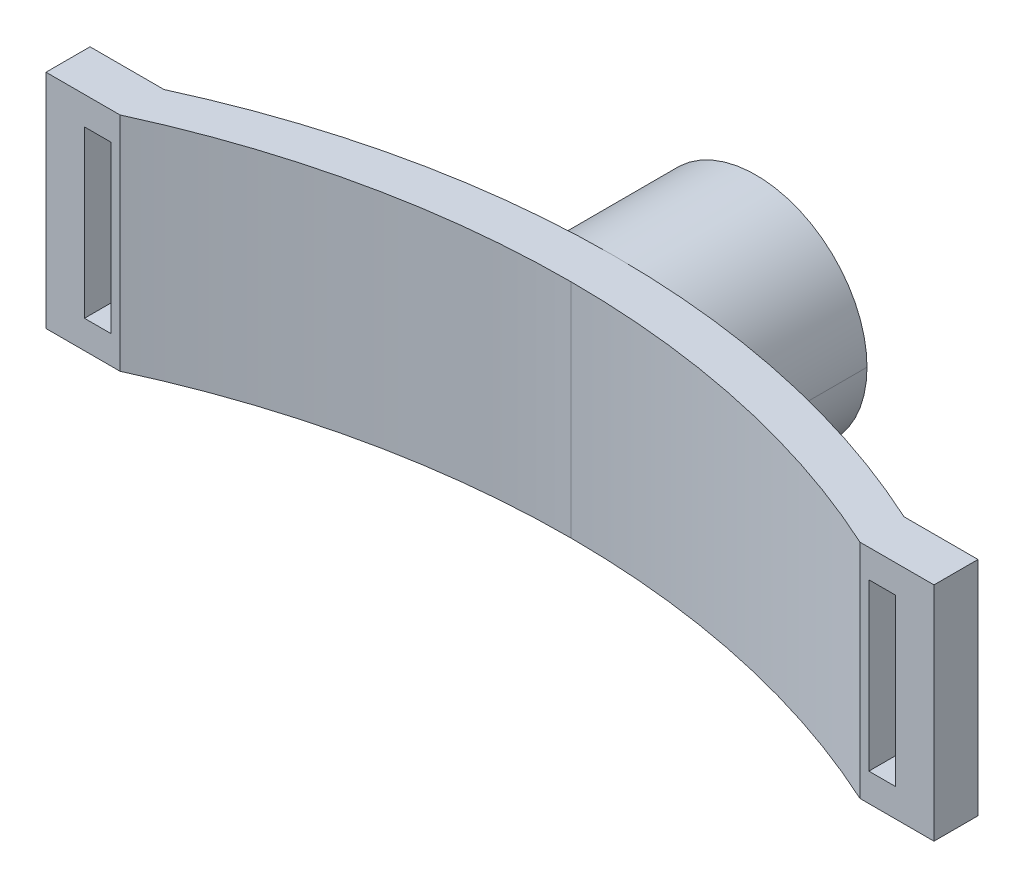
from build123d import *

# Parameters (mm, degrees)
BOSS_EXTRUDE1_START         = -15
BOSS_EXTRUDE1_DEPTH         = 30
BOSS_EXTRUDE1_START_2       = -12.7
BOSS_EXTRUDE1_2_OUTLINE_W   = 10
BOSS_EXTRUDE1_2_OUTLINE_H   = 5.949524979
BOSS_EXTRUDE1_2_DEPTH       = 25.4
BOSS_EXTRUDE1_3_OUTLINE_R   = 15
BOSS_EXTRUDE1_3_OUTLINE_R_2 = 4.55
BOSS_EXTRUDE1_3_DEPTH       = 19.994560744
SKETCH4_W                   = 3.6
SKETCH4_H                   = 22.4
CUT_EXTRUDE1_DEPTH          = 6
BOSS_EXTRUDE2_REACH         = 73.536
BOSS_EXTRUDE2_END_RADIUS    = 119.634966004
SKETCH9_R                   = 6.57997386
SKETCH9_R_2                 = 3.45
SKETCH10_W                  = 5.949524979
SKETCH10_H                  = 2.3
BOSS_EXTRUDE3_DEPTH         = 10
SKETCH11_W                  = 5.949524979
SKETCH11_H                  = 30
BOSS_EXTRUDE4_DEPTH         = 10
SKETCH13_W                  = 3.6
SKETCH13_H                  = 22.4
CUT_EXTRUDE2_DEPTH          = 10
CUT_EXTRUDE3_DEPTH          = 5


with BuildPart() as part:
    # Boss-Extrude1: read off the stored shape, not the designer's step
    # Boss-Extrude1 outline → Boss-Extrude1 (new body)
    with BuildSketch(Plane(origin=(0, 0, 0), x_dir=(1, 0, 0), z_dir=(0, 1, 0)).offset(BOSS_EXTRUDE1_START)):
        with BuildLine():
            Line((-50, -30), (-50, -35.949524979))
            ThreePointArc((-50, -35.949524979), (-25.592440765, -27.769436157), (0, -25))
            ThreePointArc((0, -25), (25.592440765, -27.769436157), (50, -35.949524979))
            Line((50, -35.949524979), (50, -30))
            ThreePointArc((50, -30), (27.810549479, -22.327809439), (4.550000287, -19.13702996))
            ThreePointArc((4.550000287, -19.13702996), (2.275411741, -19.072115713), (0, -19.050475021))
            ThreePointArc((0, -19.050475021), (-25.592440765, -21.819911178), (-50, -30))
        make_face()
    extrude(amount=BOSS_EXTRUDE1_DEPTH)

    # Boss-Extrude1 2 outline → Boss-Extrude1 2 (add)
    with BuildSketch(Plane(origin=(0, 0, 0), x_dir=(1, 0, 0), z_dir=(0, 1, 0)).offset(BOSS_EXTRUDE1_START_2)):
        with Locations((-55, -32.97476249)):
            Rectangle(BOSS_EXTRUDE1_2_OUTLINE_W, BOSS_EXTRUDE1_2_OUTLINE_H)
    extrude(amount=BOSS_EXTRUDE1_2_DEPTH)

    # Boss-Extrude1 3 outline → Boss-Extrude1 3 (add)
    with BuildSketch(Plane.XY):
        Circle(BOSS_EXTRUDE1_3_OUTLINE_R)
        Circle(BOSS_EXTRUDE1_3_OUTLINE_R_2, mode=Mode.SUBTRACT)
    extrude(amount=BOSS_EXTRUDE1_3_DEPTH)

    # Sketch4 → Cut-Extrude1 (cut)
    with BuildSketch(Plane.XY.offset(35.949524979)):
        with Locations((-53, 0)):
            Rectangle(SKETCH4_W, SKETCH4_H)
    extrude(amount=-CUT_EXTRUDE1_DEPTH, mode=Mode.SUBTRACT)

    # Boss-Extrude2: up to this cylinder (the profile starts outside it)
    boss_extrude2_end = Plane(origin=(0, 0, 138.685441025), z_dir=(0, -1, 0)) * Cylinder(BOSS_EXTRUDE2_END_RADIUS, 387.341932008, mode=Mode.PRIVATE)
    # Sketch9 → Boss-Extrude2 (add, up to the surface)
    with BuildSketch(Plane(origin=(0, 0, 0), x_dir=(-1, 0, 0), z_dir=(0, 0, -1)), mode=Mode.PRIVATE) as boss_extrude2_sk1:
        Circle(SKETCH9_R)
        Circle(SKETCH9_R_2, mode=Mode.SUBTRACT)
    boss_extrude2_tool1 = extrude(boss_extrude2_sk1.sketch, amount=-BOSS_EXTRUDE2_REACH, mode=Mode.PRIVATE) - boss_extrude2_end
    add(boss_extrude2_tool1.solids().sort_by_distance((6.393864, 0, 0))[0])

    # Sketch10 → Boss-Extrude3 (add)
    with BuildSketch(Plane.ZY.offset(50)):
        with Locations((32.97476249, 13.85)):
            Rectangle(SKETCH10_W, SKETCH10_H)
        with Locations((32.97476249, -13.85)):
            Rectangle(SKETCH10_W, SKETCH10_H)
    extrude(amount=BOSS_EXTRUDE3_DEPTH)

    # Sketch11 → Boss-Extrude4 (add)
    with BuildSketch(Plane(origin=(50, 0, 0), x_dir=(0, 0, -1), z_dir=(1, 0, 0))):
        with Locations((-32.97476249, 0)):
            Rectangle(SKETCH11_W, SKETCH11_H)
    extrude(amount=BOSS_EXTRUDE4_DEPTH)

    # Sketch13 → Cut-Extrude2 (cut)
    with BuildSketch(Plane.XY.offset(35.949524979)):
        with Locations((53, 0)):
            Rectangle(SKETCH13_W, SKETCH13_H)
    extrude(amount=-CUT_EXTRUDE2_DEPTH, mode=Mode.SUBTRACT)

    # Sketch15 → Cut-Extrude3 (cut)
    with BuildSketch(Plane(origin=(0, 0, 0), x_dir=(-1, 0, 0), z_dir=(0, 0, -1))):
        Polygon((0, 5.831237719), (-5.05, 2.915618859), (-5.05, -2.915618859), (0, -5.831237719), (5.05, -2.915618859), (5.05, 2.915618859), align=None)
    extrude(amount=-CUT_EXTRUDE3_DEPTH, mode=Mode.SUBTRACT)


solid = part.part
